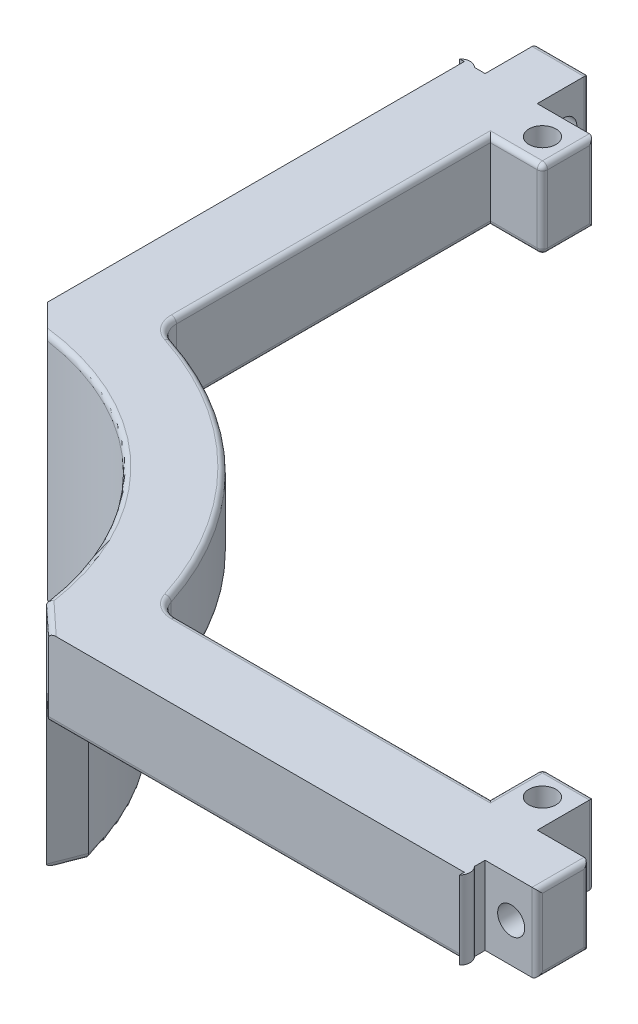
from build123d import *

# Parameters (mm, degrees)
SKETCH1_R           = 3.302
BOSS_EXTRUDE1_DEPTH = 19.05
CHAMFER1_SIZE       = 6.593417442
CHAMFER1_SIZE_2     = 6.35
FILLET1_R           = 5.08
FILLET2_R           = 1.27
FILLET3_R           = 1.27
BOSS_EXTRUDE2_START = 38.1
BOSS_EXTRUDE2_DEPTH = 38.1
FILLET5_R           = 2.54
FILLET6_R           = 1.27
SKETCH7_W           = 12.7
SKETCH7_H           = 19.05
BOSS_EXTRUDE3_DEPTH = 12.7
CUT_EXTRUDE5_REACH  = 244.877
SKETCH8_R           = 3.302
SKETCH9_W           = 12.7
SKETCH9_H           = 19.05
BOSS_EXTRUDE4_DEPTH = 12.7
CUT_EXTRUDE6_REACH  = 261.3
SKETCH10_R          = 3.302
FILLET7_R           = 1.27


with BuildPart() as part:
    # Sketch1 → Boss-Extrude1 (new body)
    with BuildSketch(Plane(origin=(0, 0, 0), x_dir=(1, 0, 0), z_dir=(0, 1, 0))):
        with BuildLine():
            Line((0, 0), (0, -107.95))
            ThreePointArc((0, -107.95), (44.047088178, -127.137896363), (63.234984541, -171.184984541))
            Line((63.234984541, -171.184984541), (171.184984541, -171.184984541))
            Line((171.184984541, -171.184984541), (171.184984541, -172.327984541))
            Line((171.184984541, -172.327984541), (173.724984541, -172.327984541))
            Line((173.724984541, -172.327984541), (171.184984541, -168.644984541))
            Line((171.184984541, -168.644984541), (171.184984541, -139.434984541))
            Line((171.184984541, -139.434984541), (158.484984541, -139.434984541))
            Line((158.484984541, -139.434984541), (158.484984541, -152.134984541))
            Line((158.484984541, -152.134984541), (78.172986392, -152.134984541))
            ThreePointArc((78.172986392, -152.134984541), (56.455029962, -114.729954579), (19.05, -93.011998149))
            Line((19.05, -93.011998149), (19.05, -12.7))
            Line((19.05, -12.7), (31.75, -12.7))
            Line((31.75, -12.7), (31.75, 0))
            Line((31.75, 0), (2.54, 0))
            Line((2.54, 0), (-1.143, 2.54))
            Line((-1.143, 2.54), (-1.143, 0))
            Line((-1.143, 0), (0, 0))
        make_face()
        with Locations(Location((25.4, -6.35, 0), (0, 0, 90))):
            Circle(SKETCH1_R, mode=Mode.SUBTRACT)
        with Locations(Location((164.834984541, -145.784984541, 0), (0, 0, 90))):
            Circle(SKETCH1_R, mode=Mode.SUBTRACT)
    extrude(amount=BOSS_EXTRUDE1_DEPTH)

    # Chamfer1
    # the kernel refuses this chamfer: 6.593417442, 6.35 mm, written as the material it takes off along each edge
    with BuildSketch(Plane(origin=(63.234984541, -17.246656522, 171.184984541), x_dir=(-0.0872058515963271, 0, -0.9961903128656489), z_dir=(0, 1, 0))) as chamfer1_piece_1:
        with BuildLine():
            Line((6.700635555, 0), (-CHAMFER1_SIZE * 0.0872058515927, -CHAMFER1_SIZE * 0.996190312824))
            Line((-CHAMFER1_SIZE * 0.0872058515927, -CHAMFER1_SIZE * 0.996190312824), (0, 0))
            ThreePointArc((0, 0), (3.448459053, -0.085459063), (6.700635555, 0))
        make_face()
    extrude(amount=53.543313044, mode=Mode.SUBTRACT)
    with BuildSketch(Plane(origin=(0, -18.02411909, 107.95), x_dir=(0, 0, -1), z_dir=(0, 1, 0))) as chamfer1_piece_2:
        with BuildLine():
            Line((CHAMFER1_SIZE_2, 0), (-0.627104296, -6.977104296))
            ThreePointArc((-0.627104296, -6.977104296), (-0.229600221, -3.597999822), (0, 0))
            Line((0, 0), (CHAMFER1_SIZE_2, 0))
        make_face()
    extrude(amount=55.098238181, mode=Mode.SUBTRACT)

    # Fillet1
    fillet1_edges = [part.edges().sort_by_distance(p)[0] for p in [
        (19.05, 9.525, 93.011998149),
        (78.172986392, 9.525, 152.134984541),
    ]]
    fillet(fillet1_edges, radius=FILLET1_R)

    # Fillet2
    fillet2_edges = [part.edges().sort_by_distance(p)[0] for p in [
        (158.484984541, 19.05, 145.784984541),
        (120.223999201, 19.05, 152.134984541),
        (31.75, 0, 6.35),
        (25.4, 0, 12.7),
        (120.223999201, 0, 152.134984541),
        (158.484984541, 0, 145.784984541),
        (164.834984541, 0, 139.434984541),
        (25.4, 19.05, 12.7),
        (31.75, 9.525, 0),
        (31.75, 9.525, 12.7),
        (158.484984541, 9.525, 139.434984541),
        (171.184984541, 9.525, 139.434984541),
        (31.75, 19.05, 6.35),
        (44.154800127, 19.05, 127.245858784),
        (66.239525947, 19.05, 167.847430426),
        (56.455029962, 0, 114.729954579),
        (56.455029962, 19.05, 114.729954579),
        (19.05, 0, 50.96098534),
        (19.05, 19.05, 50.96098534),
        (78.969227792, 0, 151.159085536),
        (78.969227792, 19.05, 151.159085536),
        (20.025899005, 0, 92.215756749),
        (20.025899005, 19.05, 92.215756749),
        (164.834984541, 19.05, 139.434984541),
    ]]
    fillet(fillet2_edges, radius=FILLET2_R)

    # Fillet3
    fillet3_edges = [part.edges().sort_by_distance(p)[0] for p in [
        (120.506693262, 0, 171.184984541),
    ]]
    fillet(fillet3_edges, radius=FILLET3_R)

    # Sketch6 → Boss-Extrude2 (add)
    with BuildSketch(Plane.XZ.offset(BOSS_EXTRUDE2_START)):
        with BuildLine():
            Line((6.977104296, 108.577104296), (14.376413508, 105.755665739))
            ThreePointArc((14.376413508, 105.755665739), (47.125159878, 124.289265483), (65.50643038, 157.123753494))
            Line((65.50643038, 157.123753494), (62.650649911, 164.509876311))
            ThreePointArc((62.650649911, 164.509876311), (44.154800127, 127.245858784), (6.977104296, 108.577104296))
        make_face()
    extrude(amount=-BOSS_EXTRUDE2_DEPTH)

    # Fillet5
    # the kernel refuses this fillet: 2.54 mm, written as the material it takes off along each edge
    with BuildSketch(Plane(origin=(173.724984541, -9.855086022, 172.327984541), x_dir=(-0.5677329558036762, 0, -0.8232127859152948), z_dir=(0, 1, 0))) as fillet5_piece_1:
        with BuildLine():
            CenterArc((3.942034409, 2.54), FILLET5_R, 190.182679729, 79.817320271)
            Line((1.442041708, 2.090960476), (0, 0))
            Line((0, 0), (3.942034409, 0))
        make_face()
    extrude(amount=38.760172045, mode=Mode.SUBTRACT)
    with BuildSketch(Plane(origin=(-1.143, -9.855086022, -2.54), x_dir=(0, 0, 1), z_dir=(0, 1, 0))) as fillet5_piece_2:
        with BuildLine():
            CenterArc((4.328983323, 1.80309142), FILLET5_R, 145.407711312, 79.817320271)
            Line((2.238022847, 3.245133128), (0, 0))
            Line((0, 0), (2.54, 0))
        make_face()
    extrude(amount=38.760172045, mode=Mode.SUBTRACT)

    # Fillet6
    fillet6_edges = [part.edges().sort_by_distance(p)[0] for p in [
        (47.125159878, -38.1, 124.289265483),
        (64.078540146, -38.1, 160.816814902),
        (44.154800127, -38.1, 127.245858784),
        (10.676758902, -38.1, 107.166385018),
    ]]
    fillet(fillet6_edges, radius=FILLET6_R)

    # Sketch7 → Boss-Extrude3 (add)
    with BuildSketch(Plane(origin=(0, 0, 0), x_dir=(-1, 0, 0), z_dir=(0, 0, -1))):
        with Locations((-11.43, 9.525)):
            Rectangle(SKETCH7_W, SKETCH7_H)
    extrude(amount=BOSS_EXTRUDE3_DEPTH)

    # Sketch8 → Cut-Extrude5 (cut, up to next)
    with BuildSketch(Plane.ZY.offset(-5.08), mode=Mode.PRIVATE) as cut_extrude5_sk1:
        with Locations((-6.35, 9.525)):
            Circle(SKETCH8_R)
    cut_extrude5_tool1 = extrude(cut_extrude5_sk1.sketch, amount=-CUT_EXTRUDE5_REACH, mode=Mode.PRIVATE) & part.part
    add(cut_extrude5_tool1.solids().sort_by_distance((5.08, 9.525, -6.35))[0], mode=Mode.SUBTRACT)

    # Sketch9 → Boss-Extrude4 (add)
    with BuildSketch(Plane(origin=(171.184984541, 0, -171.184984541), x_dir=(0, 0, 1), z_dir=(-1, 0, 0))):
        with Locations((330.939969082, 9.525)):
            Rectangle(SKETCH9_W, SKETCH9_H)
    extrude(amount=-BOSS_EXTRUDE4_DEPTH)

    # Sketch10 → Cut-Extrude6 (cut, up to next)
    with BuildSketch(Plane.XY.offset(166.104984541), mode=Mode.PRIVATE) as cut_extrude6_sk1:
        with Locations((177.534984541, 9.525)):
            Circle(SKETCH10_R)
    cut_extrude6_tool1 = extrude(cut_extrude6_sk1.sketch, amount=-CUT_EXTRUDE6_REACH, mode=Mode.PRIVATE) & part.part
    add(cut_extrude6_tool1.solids().sort_by_distance((177.534985, 9.525, 166.104985))[0], mode=Mode.SUBTRACT)

    # Fillet7
    fillet7_edges = [part.edges().sort_by_distance(p)[0] for p in [
        (17.78, 9.525, -12.7),
        (11.43, 0, -12.7),
        (5.08, 9.525, -12.7),
        (11.43, 19.05, -12.7),
        (183.884984541, 9.525, 153.404984541),
        (183.884984541, 19.05, 159.754984541),
        (183.884984541, 9.525, 166.104984541),
        (183.884984541, 0, 159.754984541),
    ]]
    fillet(fillet7_edges, radius=FILLET7_R)


solid = part.part
